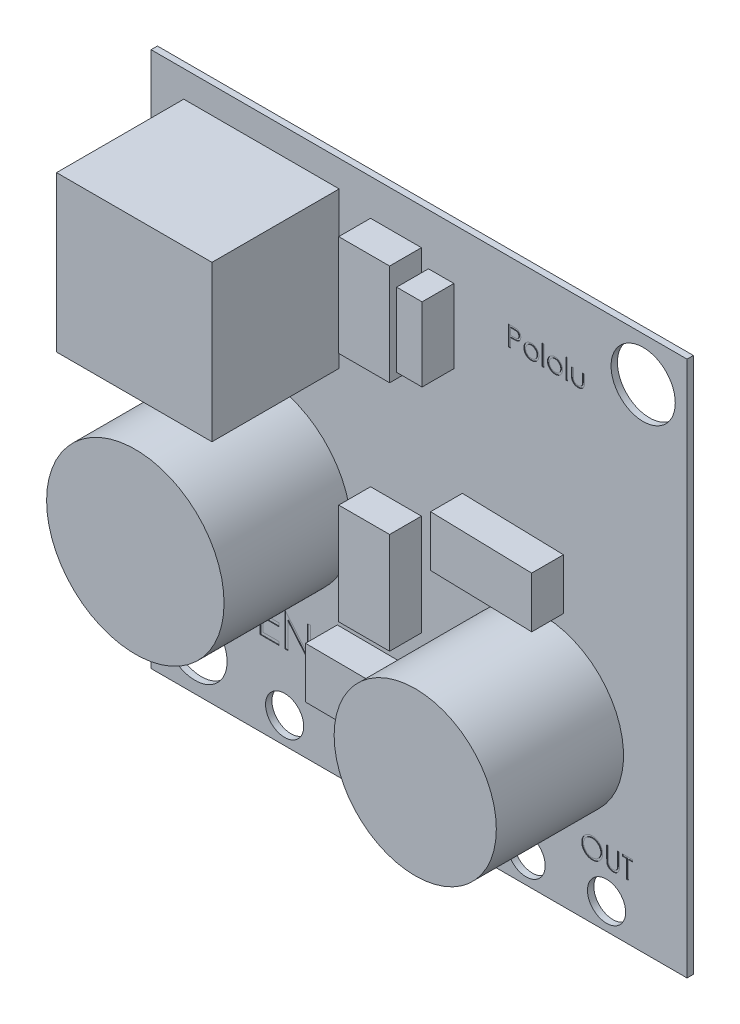
from build123d import *

# Parameters (mm, degrees)
SKETCH1_W           = 21.403638807
SKETCH1_H           = 21.403638807
SKETCH1_R           = 1.2827
SKETCH1_R_2         = 0.762
BOSS_EXTRUDE2_DEPTH = 0.254
SKETCH2_R           = 3.5433
SKETCH2_R_2         = 3.2385
SKETCH2_W           = 6.206288666
SKETCH2_H           = 6.206288667
BOSS_EXTRUDE3_DEPTH = 5.08
SKETCH3_W           = 2.032
SKETCH3_H           = 4.0386
SKETCH3_W_2         = 1.016
SKETCH3_H_2         = 2.9464
BOSS_EXTRUDE4_DEPTH = 1.27
SKETCH4_W           = 0.071233974
SKETCH4_H           = 0.814102564
SKETCH4_W_2         = 0.071233975
SKETCH4_H_2         = 0.79375
CUT_EXTRUDE1_DEPTH  = 0.0254


with BuildPart() as part:
    # Sketch1 → Boss-Extrude2 (new body)
    with BuildSketch(Plane.XY):
        with Locations((9.618180597, 10.120686142)):
            Rectangle(SKETCH1_W, SKETCH1_H)
        with Locations((0.668961193, 1.171466738)):
            Circle(SKETCH1_R, mode=Mode.SUBTRACT)
        with Locations((18.5674, 19.069905545)):
            Circle(SKETCH1_R, mode=Mode.SUBTRACT)
        with Locations((4.250361193, 0.465539417)):
            Circle(SKETCH1_R_2, mode=Mode.SUBTRACT)
        with Locations((7.464288954, 0.465539417)):
            Circle(SKETCH1_R_2, mode=Mode.SUBTRACT)
        with Locations((10.678216716, 0.465539417)):
            Circle(SKETCH1_R_2, mode=Mode.SUBTRACT)
        with Locations((13.892144477, 0.465539417)):
            Circle(SKETCH1_R_2, mode=Mode.SUBTRACT)
        with Locations((17.106072239, 0.465539417)):
            Circle(SKETCH1_R_2, mode=Mode.SUBTRACT)
    extrude(amount=BOSS_EXTRUDE2_DEPTH)

    # Sketch2 → Boss-Extrude3 (add)
    with BuildSketch(Plane.XY.offset(0.254)):
        with Locations((3.367424674, 8.222212501)):
            Circle(SKETCH2_R)
        with Locations((14.545239743, 5.842060174)):
            Circle(SKETCH2_R_2)
        with Locations((3.324815917, 16.660413121)):
            Rectangle(SKETCH2_W, SKETCH2_H)
    extrude(amount=BOSS_EXTRUDE3_DEPTH)

    # Sketch3 → Boss-Extrude4 (add)
    with BuildSketch(Plane.XY.offset(0.254)):
        Polygon((6.3543759, 4.646336431), (10.392892165, 4.620330016), (10.393031369, 2.588330021), (6.354515103, 2.614336436), align=None)
        with Locations((8.696702908, 8.069982675)):
            Rectangle(SKETCH3_W, SKETCH3_H)
        with Locations((8.696702908, 17.354271733)):
            Rectangle(SKETCH3_W, SKETCH3_H)
        Polygon((11.34760699, 11.694074063), (15.38486701, 11.590047681), (15.387094643, 9.558048902), (11.349834623, 9.662075284), align=None)
        with Locations((10.50132769, 17.309698928)):
            Rectangle(SKETCH3_W_2, SKETCH3_H_2)
    extrude(amount=BOSS_EXTRUDE4_DEPTH)

    # Sketch4 → Cut-Extrude1 (cut)
    # profile 1 of 17: a face of its own
    with BuildSketch(Plane.XY.offset(0.254)):
        with BuildLine():
            Line((13.191799409, 18.469298806), (13.347464724, 18.469298806))
            add(Edge.make_bspline(
                [(13.347464724, 18.469298806), (13.358171483, 18.469287037), (13.378686109, 18.469264486), (13.40810363, 18.468580785), (13.434821194, 18.467667589), (13.458781192, 18.466401695), (13.480057342, 18.464905683), (13.498553373, 18.462807453), (13.514414665, 18.460616635), (13.523918449, 18.458389281), (13.528252735, 18.457373476)],
                knots=[0, 0, 0, 0, 1.415646017, 2.712440637, 3.8905458, 4.950247383, 5.884950622, 6.709939814, 7.411656543, 8, 8, 8, 8], degree=3))
            add(Edge.make_bspline(
                [(13.528252735, 18.457373476), (13.533739482, 18.455871712), (13.54458369, 18.452903572), (13.560209462, 18.446958674), (13.575076138, 18.439909683), (13.589234723, 18.43187604), (13.602511231, 18.422513063), (13.615103744, 18.412200297), (13.626901133, 18.400699637), (13.637837055, 18.388140077), (13.647880215, 18.374732458), (13.656527482, 18.36027663), (13.663768121, 18.345015924), (13.669978256, 18.328960954), (13.674447852, 18.311976898), (13.677814917, 18.294181769), (13.679952061, 18.275577473), (13.680156749, 18.262863896), (13.680260948, 18.256391905)],
                knots=[0, 0, 0, 0, 0.999701418, 1.975846123, 2.934577507, 3.890451536, 4.834027766, 5.787354733, 6.749476667, 7.726910423, 8.712836071, 9.690891519, 10.682875813, 11.679750201, 12.712814741, 13.765529915, 14.8625177, 16, 16, 16, 16], degree=3))
            add(Edge.make_bspline(
                [(13.680260948, 18.256391905), (13.680165375, 18.249865517), (13.679978379, 18.237096196), (13.677734043, 18.218415225), (13.674710946, 18.200563018), (13.670062508, 18.183579161), (13.663974292, 18.167564513), (13.656832345, 18.152274341), (13.648218223, 18.137968772), (13.638320199, 18.124595872), (13.627309391, 18.112143089), (13.615232385, 18.100700662), (13.602137938, 18.090335571), (13.588067666, 18.081024579), (13.572884396, 18.072983601), (13.556818408, 18.065781498), (13.539730055, 18.059732883), (13.527904878, 18.056551065), (13.521892558, 18.054933322)],
                knots=[0, 0, 0, 0, 1.121902311, 2.195077645, 3.232258892, 4.234102512, 5.217864754, 6.176164875, 7.132989551, 8.084763148, 9.034132444, 9.988522005, 10.94243251, 11.903244335, 12.886203696, 13.894208494, 14.929344452, 16, 16, 16, 16], degree=3))
            add(Edge.make_bspline(
                [(13.521892558, 18.054933322), (13.516919752, 18.053875824), (13.506021558, 18.051558257), (13.48807312, 18.048970982), (13.467175863, 18.046762633), (13.44335831, 18.045106839), (13.41664184, 18.043689345), (13.387012002, 18.042562652), (13.35441063, 18.041943561), (13.331670545, 18.041911631), (13.319797957, 18.04189496)],
                knots=[0, 0, 0, 0, 0.601384939, 1.31797006, 2.144135048, 3.087295005, 4.142315834, 5.309527816, 6.595305764, 8, 8, 8, 8], degree=3))
            Line((13.319797957, 18.04189496), (13.263033384, 18.04189496))
            Line((13.263033384, 18.04189496), (13.263033384, 17.675548806))
            Line((13.263033384, 17.675548806), (13.191799409, 17.675548806))
            Line((13.191799409, 17.675548806), (13.191799409, 18.469298806))
        make_face()
        with BuildLine():
            Line((13.263033384, 18.38788855), (13.263033384, 18.123305217))
            Line((13.263033384, 18.123305217), (13.402003235, 18.121556168))
            add(Edge.make_bspline(
                [(13.402003235, 18.121556168), (13.408788647, 18.121552661), (13.421887745, 18.121545891), (13.440809888, 18.122449683), (13.458365209, 18.123493018), (13.474499782, 18.125020629), (13.489220881, 18.127179914), (13.502553053, 18.129359719), (13.514392919, 18.132513257), (13.528249345, 18.136759381), (13.543689676, 18.144001242), (13.560487138, 18.154512735), (13.57472261, 18.167911396), (13.587041224, 18.182976279), (13.596817021, 18.199735546), (13.603973469, 18.217667251), (13.608178339, 18.236587496), (13.608742172, 18.24953427), (13.609026973, 18.256073896)],
                knots=[0, 0, 0, 0, 1.160613943, 2.240541288, 3.23993089, 4.169200891, 5.011653406, 5.7853311, 6.478053781, 7.106038997, 8.262395093, 9.384106736, 10.481365981, 11.59014053, 12.70357646, 13.786202915, 14.881775077, 16, 16, 16, 16], degree=3))
            add(Edge.make_bspline(
                [(13.609026973, 18.256073896), (13.608740623, 18.262455309), (13.608171394, 18.275140768), (13.603940511, 18.29373238), (13.596830935, 18.31147512), (13.5869756, 18.328024374), (13.575014665, 18.343035049), (13.56111285, 18.356074576), (13.545302878, 18.366556998), (13.530596226, 18.37332276), (13.517533099, 18.377453724), (13.506186566, 18.380344072), (13.493375288, 18.382651754), (13.479095095, 18.384520355), (13.46345667, 18.38611998), (13.446325659, 18.387205371), (13.427766958, 18.387840701), (13.414883132, 18.387872214), (13.408204407, 18.38788855)],
                knots=[0, 0, 0, 0, 1.120700087, 2.227813068, 3.331159281, 4.466773991, 5.599788987, 6.693661531, 7.80175334, 8.91857717, 9.525282508, 10.207424825, 10.974604443, 11.810962634, 12.737642355, 13.736264703, 14.826523623, 16, 16, 16, 16], degree=3))
            Line((13.408204407, 18.38788855), (13.263033384, 18.38788855))
        make_face(mode=Mode.SUBTRACT)
    # profile 2 of 17: a face of its own
    with BuildSketch(Plane.XY.offset(0.254)):
        with BuildLine():
            add(Edge.make_bspline(
                [(14.102894662, 18.265773165), (14.113778397, 18.265541415), (14.135118741, 18.265087009), (14.166371601, 18.260230401), (14.196204159, 18.252803767), (14.22473067, 18.242536823), (14.251585794, 18.228775024), (14.277160702, 18.212353631), (14.301385273, 18.192899364), (14.315904782, 18.177850302), (14.32327477, 18.170211517)],
                knots=[0, 0, 0, 0, 1.054011418, 2.066658804, 3.057071809, 4.030435133, 4.997543892, 5.974964718, 6.972108034, 8, 8, 8, 8], degree=3))
            add(Edge.make_bspline(
                [(14.32327477, 18.170211517), (14.329620677, 18.162905845), (14.342189681, 18.148435886), (14.358306371, 18.124973631), (14.372190546, 18.100675787), (14.383317325, 18.075219697), (14.392090536, 18.048827584), (14.398319363, 18.021408735), (14.402024347, 17.993023703), (14.402523948, 17.973746046), (14.402776973, 17.963982801)],
                knots=[0, 0, 0, 0, 1.025258237, 2.030674902, 3.01204498, 3.988269485, 4.97094183, 5.956517959, 6.965070386, 8, 8, 8, 8], degree=3))
            add(Edge.make_bspline(
                [(14.402776973, 17.963982801), (14.40255442, 17.954162966), (14.402114644, 17.934758515), (14.397954574, 17.906179123), (14.391484132, 17.878467083), (14.382224054, 17.851738415), (14.370349983, 17.825911417), (14.355860488, 17.801098894), (14.338653889, 17.777251892), (14.319149411, 17.754572904), (14.297593003, 17.733670923), (14.274207734, 17.715453619), (14.249453158, 17.699845881), (14.223000112, 17.687273694), (14.195090164, 17.677360958), (14.165663115, 17.670398633), (14.134764679, 17.666189108), (14.113667434, 17.665648548), (14.102894662, 17.665372524)],
                knots=[0, 0, 0, 0, 0.998656419, 1.973391657, 2.932242238, 3.890759089, 4.846373663, 5.82037756, 6.809684879, 7.83454468, 8.860553229, 9.859544525, 10.845671541, 11.83227036, 12.833544569, 13.85385346, 14.904124723, 16, 16, 16, 16], degree=3))
            add(Edge.make_bspline(
                [(14.102894662, 17.665372524), (14.092069109, 17.665649474), (14.070866718, 17.666191894), (14.039859218, 17.670382278), (14.01037943, 17.677357749), (13.982432944, 17.68730627), (13.955866166, 17.699846283), (13.930968157, 17.715406434), (13.907563891, 17.733676326), (13.886002923, 17.75457144), (13.866499668, 17.77725227), (13.849292753, 17.801098796), (13.83480334, 17.825911442), (13.822929247, 17.851738408), (13.813669175, 17.878467085), (13.807198731, 17.906179123), (13.803038661, 17.934758515), (13.802598886, 17.954162966), (13.802376332, 17.963982801)],
                knots=[0, 0, 0, 0, 1.099876186, 2.154163076, 3.173186993, 4.173200201, 5.163417411, 6.152872554, 7.150605724, 8.17532212, 9.198891216, 10.186952605, 11.159729845, 12.11414092, 13.071450619, 14.029093627, 15.002601286, 16, 16, 16, 16], degree=3))
            add(Edge.make_bspline(
                [(13.802376332, 17.963982801), (13.802631083, 17.973692982), (13.803135446, 17.992917471), (13.806836704, 18.021249144), (13.813041234, 18.048621587), (13.821824961, 18.074911829), (13.833054299, 18.100256366), (13.846743377, 18.124614247), (13.863024467, 18.147970409), (13.875543481, 18.162421666), (13.881878536, 18.169734503)],
                knots=[0, 0, 0, 0, 1.031353054, 2.041901799, 3.029428768, 4.008703097, 4.981709435, 5.96992636, 6.972712378, 8, 8, 8, 8], degree=3))
            add(Edge.make_bspline(
                [(13.881878536, 18.169734503), (13.889237413, 18.177439534), (13.903709939, 18.192592833), (13.928055097, 18.211990388), (13.953567088, 18.228753497), (13.980718991, 18.242241853), (14.009222068, 18.25286416), (14.039207503, 18.260249554), (14.070566415, 18.265069511), (14.092011186, 18.265536276), (14.102894662, 18.265773165)],
                knots=[0, 0, 0, 0, 1.027980169, 2.021703884, 2.998553061, 3.971491411, 4.943284454, 5.930300938, 6.949603206, 8, 8, 8, 8], degree=3))
        make_face()
        with BuildLine():
            add(Edge.make_bspline(
                [(14.102576653, 18.194539191), (14.094880087, 18.194320435), (14.079685642, 18.193888571), (14.057320129, 18.190603829), (14.035789059, 18.185399662), (14.015051581, 18.178005528), (13.99517763, 18.168458099), (13.976148176, 18.156731382), (13.957907248, 18.142980694), (13.940811673, 18.127227552), (13.925122113, 18.11001928), (13.911406571, 18.091684027), (13.899744092, 18.072519195), (13.890028556, 18.052504854), (13.882792461, 18.031438182), (13.877537151, 18.009557753), (13.874255507, 17.986818989), (13.873827703, 17.971361044), (13.873610307, 17.963505788)],
                knots=[0, 0, 0, 0, 1.021534396, 2.016698045, 2.994645724, 3.958388632, 4.93408049, 5.916473867, 6.921342795, 7.962252576, 8.998418191, 10.008913653, 10.997312074, 11.973003931, 12.956656626, 13.948281152, 14.957379055, 16, 16, 16, 16], degree=3))
            add(Edge.make_bspline(
                [(13.873610307, 17.963505788), (13.873974711, 17.953356667), (13.874697986, 17.933212561), (13.880579728, 17.903546467), (13.890419116, 17.875066297), (13.903705874, 17.847939009), (13.920353356, 17.822840118), (13.939967387, 17.800462835), (13.962337462, 17.78114391), (13.987196918, 17.765114504), (14.014037987, 17.752378273), (14.042444331, 17.743352434), (14.072071774, 17.737485104), (14.092319368, 17.73690193), (14.102576653, 17.736606499)],
                knots=[0, 0, 0, 0, 1.016792936, 2.018143844, 3.017858371, 4.030088057, 5.03801393, 6.028138512, 7.003788237, 7.991172063, 8.984598303, 9.972568034, 10.972917682, 12, 12, 12, 12], degree=3))
            add(Edge.make_bspline(
                [(14.102576653, 17.736606499), (14.112833347, 17.736903651), (14.133079777, 17.737490223), (14.162666055, 17.743322884), (14.190994759, 17.752417821), (14.217807949, 17.76510018), (14.242656089, 17.781204781), (14.265187051, 17.800353745), (14.284633611, 17.822899386), (14.301264624, 17.847972254), (14.314768975, 17.875024241), (14.324562308, 17.903551723), (14.330458189, 17.933211222), (14.331179556, 17.953356219), (14.331542999, 17.963505788)],
                knots=[0, 0, 0, 0, 1.02726834, 2.027799167, 3.010890988, 4.004497153, 4.992059811, 5.971914811, 6.958719428, 7.966827853, 8.981595046, 9.981490638, 10.983022906, 12, 12, 12, 12], degree=3))
            add(Edge.make_bspline(
                [(14.331542999, 17.963505788), (14.331325677, 17.971361091), (14.330898021, 17.986819128), (14.327615305, 18.009557221), (14.32236396, 18.031440136), (14.315113254, 18.052497644), (14.305439933, 18.072571016), (14.293552553, 18.091627757), (14.279893017, 18.110082795), (14.264014134, 18.127171925), (14.246936404, 18.142986835), (14.228688083, 18.156736714), (14.209686846, 18.168406562), (14.189870632, 18.178087191), (14.169130496, 18.185332392), (14.147629594, 18.190633878), (14.125359506, 18.19387469), (14.110219509, 18.194316274), (14.102576653, 18.194539191)],
                knots=[0, 0, 0, 0, 1.042956736, 2.052379634, 3.044323526, 4.02829302, 5.004299113, 5.996692471, 7.007513377, 8.048758398, 9.090003419, 10.095195979, 11.07790575, 12.047570684, 13.018257071, 13.989683339, 14.985167495, 16, 16, 16, 16], degree=3))
        make_face(mode=Mode.SUBTRACT)
    # profile 3 of 17: a face of its own
    with BuildSketch(Plane.XY.offset(0.254)):
        with Locations((14.570685627, 18.082600088)):
            Rectangle(SKETCH4_W, SKETCH4_H)
    # profile 4 of 17: a face of its own
    with BuildSketch(Plane.XY.offset(0.254)):
        with BuildLine():
            add(Edge.make_bspline(
                [(15.049288892, 18.265773165), (15.060172628, 18.265541415), (15.081512972, 18.265087009), (15.112765832, 18.260230401), (15.14259839, 18.252803767), (15.171124901, 18.242536823), (15.197980025, 18.228775024), (15.223554932, 18.212353631), (15.247779504, 18.192899364), (15.262299012, 18.177850302), (15.269669001, 18.170211517)],
                knots=[0, 0, 0, 0, 1.054011418, 2.066658804, 3.057071809, 4.030435133, 4.997543892, 5.974964718, 6.972108034, 8, 8, 8, 8], degree=3))
            add(Edge.make_bspline(
                [(15.269669001, 18.170211517), (15.276014908, 18.162905845), (15.288583912, 18.148435886), (15.304700602, 18.124973631), (15.318584777, 18.100675787), (15.329711556, 18.075219697), (15.338484767, 18.048827584), (15.344713594, 18.021408735), (15.348418578, 17.993023703), (15.348918179, 17.973746046), (15.349171204, 17.963982801)],
                knots=[0, 0, 0, 0, 1.025258237, 2.030674902, 3.01204498, 3.988269485, 4.97094183, 5.956517959, 6.965070386, 8, 8, 8, 8], degree=3))
            add(Edge.make_bspline(
                [(15.349171204, 17.963982801), (15.348948651, 17.954162966), (15.348508875, 17.934758515), (15.344348805, 17.906179123), (15.337878362, 17.878467083), (15.328618285, 17.851738415), (15.316744214, 17.825911417), (15.302254718, 17.801098894), (15.285048119, 17.777251892), (15.265543642, 17.754572904), (15.243987234, 17.733670923), (15.220601965, 17.715453619), (15.195847389, 17.699845881), (15.169394343, 17.687273694), (15.141484395, 17.677360958), (15.112057346, 17.670398633), (15.08115891, 17.666189108), (15.060061665, 17.665648548), (15.049288892, 17.665372524)],
                knots=[0, 0, 0, 0, 0.998656419, 1.973391657, 2.932242238, 3.890759089, 4.846373663, 5.82037756, 6.809684879, 7.83454468, 8.860553229, 9.859544525, 10.845671541, 11.83227036, 12.833544569, 13.85385346, 14.904124723, 16, 16, 16, 16], degree=3))
            add(Edge.make_bspline(
                [(15.049288892, 17.665372524), (15.03846334, 17.665649474), (15.017260949, 17.666191894), (14.986253449, 17.670382278), (14.956773661, 17.677357749), (14.928827175, 17.68730627), (14.902260397, 17.699846283), (14.877362388, 17.715406434), (14.853958121, 17.733676326), (14.832397153, 17.75457144), (14.812893898, 17.77725227), (14.795686984, 17.801098796), (14.781197571, 17.825911442), (14.769323478, 17.851738408), (14.760063406, 17.878467085), (14.753592962, 17.906179123), (14.749432892, 17.934758515), (14.748993116, 17.954162966), (14.748770563, 17.963982801)],
                knots=[0, 0, 0, 0, 1.099876186, 2.154163076, 3.173186993, 4.173200201, 5.163417411, 6.152872554, 7.150605724, 8.17532212, 9.198891216, 10.186952605, 11.159729845, 12.11414092, 13.071450619, 14.029093627, 15.002601286, 16, 16, 16, 16], degree=3))
            add(Edge.make_bspline(
                [(14.748770563, 17.963982801), (14.749025314, 17.973692982), (14.749529677, 17.992917471), (14.753230935, 18.021249144), (14.759435465, 18.048621587), (14.768219192, 18.074911829), (14.77944853, 18.100256366), (14.793137608, 18.124614247), (14.809418698, 18.147970409), (14.821937712, 18.162421666), (14.828272767, 18.169734503)],
                knots=[0, 0, 0, 0, 1.031353054, 2.041901799, 3.029428768, 4.008703097, 4.981709435, 5.96992636, 6.972712378, 8, 8, 8, 8], degree=3))
            add(Edge.make_bspline(
                [(14.828272767, 18.169734503), (14.835631644, 18.177439534), (14.85010417, 18.192592833), (14.874449328, 18.211990388), (14.899961319, 18.228753497), (14.927113222, 18.242241853), (14.955616299, 18.25286416), (14.985601734, 18.260249554), (15.016960646, 18.265069511), (15.038405417, 18.265536276), (15.049288892, 18.265773165)],
                knots=[0, 0, 0, 0, 1.027980169, 2.021703884, 2.998553061, 3.971491411, 4.943284454, 5.930300938, 6.949603206, 8, 8, 8, 8], degree=3))
        make_face()
        with BuildLine():
            add(Edge.make_bspline(
                [(15.048970884, 18.194539191), (15.041274318, 18.194320435), (15.026079873, 18.193888571), (15.00371436, 18.190603829), (14.982183289, 18.185399662), (14.961445812, 18.178005528), (14.941571861, 18.168458099), (14.922542407, 18.156731382), (14.904301479, 18.142980694), (14.887205903, 18.127227552), (14.871516343, 18.11001928), (14.857800802, 18.091684027), (14.846138323, 18.072519195), (14.836422787, 18.052504854), (14.829186692, 18.031438182), (14.823931382, 18.009557753), (14.820649738, 17.986818989), (14.820221934, 17.971361044), (14.820004537, 17.963505788)],
                knots=[0, 0, 0, 0, 1.021534396, 2.016698045, 2.994645724, 3.958388632, 4.93408049, 5.916473867, 6.921342795, 7.962252576, 8.998418191, 10.008913653, 10.997312074, 11.973003931, 12.956656626, 13.948281152, 14.957379055, 16, 16, 16, 16], degree=3))
            add(Edge.make_bspline(
                [(14.820004537, 17.963505788), (14.820368942, 17.953356667), (14.821092217, 17.933212561), (14.826973958, 17.903546467), (14.836813347, 17.875066297), (14.850100105, 17.847939009), (14.866747587, 17.822840118), (14.886361618, 17.800462835), (14.908731693, 17.78114391), (14.933591149, 17.765114504), (14.960432218, 17.752378273), (14.988838562, 17.743352434), (15.018466005, 17.737485104), (15.038713599, 17.73690193), (15.048970884, 17.736606499)],
                knots=[0, 0, 0, 0, 1.016792936, 2.018143844, 3.017858371, 4.030088057, 5.03801393, 6.028138512, 7.003788237, 7.991172063, 8.984598303, 9.972568034, 10.972917682, 12, 12, 12, 12], degree=3))
            add(Edge.make_bspline(
                [(15.048970884, 17.736606499), (15.059227578, 17.736903651), (15.079474008, 17.737490223), (15.109060285, 17.743322884), (15.13738899, 17.752417821), (15.164202179, 17.76510018), (15.18905032, 17.781204781), (15.211581281, 17.800353745), (15.231027841, 17.822899386), (15.247658855, 17.847972254), (15.261163206, 17.875024241), (15.270956539, 17.903551723), (15.27685242, 17.933211222), (15.277573787, 17.953356219), (15.27793723, 17.963505788)],
                knots=[0, 0, 0, 0, 1.02726834, 2.027799167, 3.010890988, 4.004497153, 4.992059811, 5.971914811, 6.958719428, 7.966827853, 8.981595046, 9.981490638, 10.983022906, 12, 12, 12, 12], degree=3))
            add(Edge.make_bspline(
                [(15.27793723, 17.963505788), (15.277719908, 17.971361091), (15.277292251, 17.986819128), (15.274009536, 18.009557221), (15.268758191, 18.031440136), (15.261507485, 18.052497644), (15.251834164, 18.072571016), (15.239946784, 18.091627757), (15.226287248, 18.110082795), (15.210408365, 18.127171925), (15.193330635, 18.142986835), (15.175082313, 18.156736714), (15.156081077, 18.168406562), (15.136264863, 18.178087191), (15.115524727, 18.185332392), (15.094023824, 18.190633878), (15.071753737, 18.19387469), (15.05661374, 18.194316274), (15.048970884, 18.194539191)],
                knots=[0, 0, 0, 0, 1.042956736, 2.052379634, 3.044323526, 4.02829302, 5.004299113, 5.996692471, 7.007513377, 8.048758398, 9.090003419, 10.095195979, 11.07790575, 12.047570684, 13.018257071, 13.989683339, 14.985167495, 16, 16, 16, 16], degree=3))
        make_face(mode=Mode.SUBTRACT)
    # profile 5 of 17: a face of its own
    with BuildSketch(Plane.XY.offset(0.254)):
        with Locations((15.517079858, 18.082600088)):
            Rectangle(SKETCH4_W, SKETCH4_H)
    # profile 6 of 17: a face of its own
    with BuildSketch(Plane.XY.offset(0.254)):
        with BuildLine():
            Line((15.705341076, 18.255596883), (15.77657505, 18.255596883))
            Line((15.77657505, 18.255596883), (15.77657505, 17.986561427))
            add(Edge.make_bspline(
                [(15.77657505, 17.986561427), (15.776607232, 17.978664124), (15.776668795, 17.963556956), (15.777086294, 17.941818369), (15.778068297, 17.921993507), (15.779296075, 17.904070918), (15.780874989, 17.888053635), (15.782753536, 17.873997602), (15.784853214, 17.861743421), (15.786908508, 17.854363053), (15.787864363, 17.850930667)],
                knots=[0, 0, 0, 0, 1.388932606, 2.656963016, 3.823490214, 4.879454478, 5.816252168, 6.653371382, 7.373723809, 8, 8, 8, 8], degree=3))
            add(Edge.make_bspline(
                [(15.787864363, 17.850930667), (15.789397765, 17.846616552), (15.792432688, 17.838078011), (15.797937568, 17.825743361), (15.804747565, 17.814318967), (15.812199705, 17.803364293), (15.820794749, 17.793203843), (15.830423951, 17.783854773), (15.840764979, 17.774963845), (15.856130851, 17.764444437), (15.877144649, 17.75316971), (15.904733756, 17.743441552), (15.93464775, 17.737627714), (15.955322606, 17.736953195), (15.965949299, 17.736606499)],
                knots=[0, 0, 0, 0, 0.725840625, 1.436591201, 2.137033971, 2.831655856, 3.53531722, 4.242432219, 4.957935707, 5.694543706, 7.190802206, 8.724350549, 10.316345118, 12, 12, 12, 12], degree=3))
            add(Edge.make_bspline(
                [(15.965949299, 17.736606499), (15.976575005, 17.736960568), (15.997133781, 17.737645625), (16.026719104, 17.743266178), (16.053763621, 17.752656397), (16.077995891, 17.765766292), (16.099306001, 17.781809581), (16.117064324, 17.800634793), (16.131716327, 17.82164635), (16.13811382, 17.837322749), (16.14133116, 17.845206509)],
                knots=[0, 0, 0, 0, 1.157059328, 2.238695713, 3.266970494, 4.264342957, 5.228770407, 6.160125903, 7.074715775, 8, 8, 8, 8], degree=3))
            add(Edge.make_bspline(
                [(16.14133116, 17.845206509), (16.142282352, 17.848373866), (16.144385204, 17.855376118), (16.146644523, 17.867255097), (16.148679802, 17.881421177), (16.150417701, 17.897967057), (16.151657122, 17.916849497), (16.152325239, 17.938062596), (16.153080044, 17.961539762), (16.1530915, 17.977974414), (16.153097486, 17.986561427)],
                knots=[0, 0, 0, 0, 0.557542046, 1.232589297, 2.036731608, 2.971723315, 4.038036528, 5.22795436, 6.551621927, 8, 8, 8, 8], degree=3))
            Line((16.153097486, 17.986561427), (16.153097486, 18.255596883))
            Line((16.153097486, 18.255596883), (16.224331461, 18.255596883))
            Line((16.224331461, 18.255596883), (16.224331461, 17.973205056))
            add(Edge.make_bspline(
                [(16.224331461, 17.973205056), (16.22423129, 17.963610394), (16.224036947, 17.944995437), (16.22278796, 17.917943505), (16.220644923, 17.892733496), (16.217392207, 17.869352066), (16.213567313, 17.847817065), (16.208633301, 17.828100894), (16.202741808, 17.810264299), (16.196095735, 17.793994289), (16.188243991, 17.779242583), (16.179892148, 17.765241781), (16.170248138, 17.752339276), (16.160094888, 17.739892792), (16.148800584, 17.72852141), (16.136576866, 17.7179642), (16.123595783, 17.70805978), (16.109569269, 17.699194437), (16.09470209, 17.691207804), (16.078975894, 17.684128444), (16.06219806, 17.678526252), (16.044585057, 17.673693298), (16.026050591, 17.669902695), (16.00661253, 17.66722967), (15.986277423, 17.665591068), (15.97241867, 17.665446595), (15.965313281, 17.665372524)],
                knots=[0, 0, 0, 0, 1.493040784, 2.896703357, 4.213163133, 5.428574705, 6.569057535, 7.615249723, 8.588095153, 9.490268104, 10.346124644, 11.18633936, 12.024365274, 12.850166724, 13.684164916, 14.514361689, 15.362232829, 16.222528818, 17.093394965, 17.986930858, 18.902426812, 19.842810585, 20.827885679, 21.843828298, 22.894529745, 24, 24, 24, 24], degree=3))
            add(Edge.make_bspline(
                [(15.965313281, 17.665372524), (15.958261036, 17.665449565), (15.944402718, 17.665600957), (15.924066561, 17.667220617), (15.904574645, 17.669898542), (15.885996269, 17.673721064), (15.868312789, 17.678492425), (15.851452578, 17.684162869), (15.835613055, 17.691211479), (15.820603922, 17.699143889), (15.806542666, 17.708116728), (15.793364471, 17.71795198), (15.781087006, 17.728634962), (15.769707564, 17.740121059), (15.759385871, 17.752552757), (15.749993305, 17.765830054), (15.741385266, 17.779821392), (15.733594544, 17.794803573), (15.726901699, 17.811261868), (15.720992742, 17.829472103), (15.716159794, 17.849633924), (15.712226769, 17.871730093), (15.709062782, 17.895654862), (15.706866103, 17.921546627), (15.70563787, 17.949342322), (15.70544214, 17.968539707), (15.705341076, 17.978452202)],
                knots=[0, 0, 0, 0, 1.083640291, 2.129454052, 3.13281866, 4.105697902, 5.042300162, 5.946461698, 6.836384745, 7.703652036, 8.553297018, 9.397182691, 10.228592656, 11.052265423, 11.879314572, 12.708807002, 13.549817954, 14.402308542, 15.300838682, 16.27712199, 17.341985831, 18.484375296, 19.725102775, 21.0496083, 22.476576903, 24, 24, 24, 24], degree=3))
            Line((15.705341076, 17.978452202), (15.705341076, 18.255596883))
        make_face()
    # profile 7 of 17: a face of its own
    with BuildSketch(Plane.XY.offset(0.254)):
        Polygon((3.27317911, 4.096791439), (4.019439794, 4.096791439), (4.019439794, 3.961107678), (3.3919024, 3.961107678), (3.3919024, 3.554056396), (4.019439794, 3.554056396), (4.019439794, 3.418372636), (3.3919024, 3.418372636), (3.3919024, 2.909558533), (4.019439794, 2.909558533), (4.019439794, 2.773874772), (3.27317911, 2.773874772), align=None)
    # profile 8 of 17: a face of its own
    with BuildSketch(Plane.XY.offset(0.254)):
        Polygon((4.256886375, 2.773874772), (4.256886375, 4.096791439), (4.281797065, 4.096791439), (5.155791289, 3.05557758), (5.155791289, 4.096791439), (5.27451458, 4.096791439), (5.27451458, 2.773874772), (5.247483831, 2.773874772), (4.375609665, 3.812703565), (4.375609665, 2.773874772), align=None)
    # profile 9 of 17: a face of its own
    with BuildSketch(Plane.XY.offset(0.254)):
        Polygon((7.071247738, 2.423342648), (7.147569853, 2.423342648), (7.412153187, 1.79781931), (7.67673652, 2.423342648), (7.753058635, 2.423342648), (7.417241328, 1.629592648), (7.407065046, 1.629592648), align=None)
    # profile 10 of 17: a face of its own
    with BuildSketch(Plane.XY.offset(0.254)):
        with Locations((7.931143572, 2.026467648)):
            Rectangle(SKETCH4_W_2, SKETCH4_H_2)
    # profile 11 of 17: a face of its own
    with BuildSketch(Plane.XY.offset(0.254)):
        Polygon((8.1702862, 1.629592648), (8.1702862, 2.423342648), (8.185232614, 2.423342648), (8.709629148, 1.798614332), (8.709629148, 2.423342648), (8.780863123, 2.423342648), (8.780863123, 1.629592648), (8.764644673, 1.629592648), (8.241520174, 2.252889923), (8.241520174, 1.629592648), align=None)
    # profile 12 of 17: a face of its own
    with BuildSketch(Plane.XY.offset(0.254)):
        with BuildLine():
            Line((11.203994747, 2.287870893), (11.142937054, 2.229993289))
            add(Edge.make_bspline(
                [(11.142937054, 2.229993289), (11.131888307, 2.240387074), (11.110054275, 2.260926798), (11.074457934, 2.287576613), (11.037318681, 2.310406246), (10.998830311, 2.328981411), (10.959945961, 2.343802483), (10.921181756, 2.354354401), (10.88293532, 2.361083708), (10.857497397, 2.361888428), (10.844962796, 2.362284955)],
                knots=[0, 0, 0, 0, 1.08915593, 2.152340314, 3.188132944, 4.216796309, 5.218260357, 6.173443236, 7.099959455, 8, 8, 8, 8], degree=3))
            add(Edge.make_bspline(
                [(10.844962796, 2.362284955), (10.837271426, 2.362191155), (10.821908635, 2.362003799), (10.799089016, 2.359612521), (10.776508725, 2.356173347), (10.754210388, 2.351197243), (10.73215065, 2.344890545), (10.710406233, 2.337001699), (10.688936576, 2.327804349), (10.667943911, 2.317176609), (10.647592047, 2.305501716), (10.628370407, 2.292563922), (10.610156476, 2.278777892), (10.593292594, 2.263798474), (10.577681757, 2.247761353), (10.562952394, 2.230964853), (10.549622543, 2.21295008), (10.537582225, 2.194048483), (10.526841287, 2.17459204), (10.517359681, 2.154768023), (10.509400163, 2.134642184), (10.503102447, 2.11418927), (10.497906638, 2.093567511), (10.494251395, 2.072634119), (10.492190656, 2.05136668), (10.491834199, 2.037125159), (10.491655003, 2.029965745)],
                knots=[0, 0, 0, 0, 1.02818874, 2.053710826, 3.065248034, 4.081641283, 5.106893873, 6.131558223, 7.173050175, 8.228653731, 9.27666206, 10.308777013, 11.325269123, 12.329503258, 13.32196095, 14.316845687, 15.314881793, 16.315733098, 17.311955233, 18.285320748, 19.252783886, 20.203351036, 21.145449891, 22.095197417, 23.042428769, 24, 24, 24, 24], degree=3))
            add(Edge.make_bspline(
                [(10.491655003, 2.029965745), (10.491826389, 2.022647184), (10.492168693, 2.008030048), (10.494359516, 1.986214607), (10.498425385, 1.964723167), (10.503860919, 1.943485108), (10.510660139, 1.922464058), (10.519135726, 1.901751149), (10.529174532, 1.88134715), (10.54079425, 1.861435904), (10.553536478, 1.842040504), (10.56781107, 1.823770756), (10.582974095, 1.806383372), (10.599577962, 1.790264404), (10.617090251, 1.774982699), (10.636034178, 1.760959286), (10.656037236, 1.747924047), (10.677129943, 1.736041264), (10.699083431, 1.725425757), (10.721593444, 1.715986052), (10.744731895, 1.708211988), (10.768377184, 1.701876025), (10.792501122, 1.696682565), (10.817226163, 1.693341449), (10.84237051, 1.690916921), (10.859320164, 1.69073965), (10.86785943, 1.69065034)],
                knots=[0, 0, 0, 0, 0.93586088, 1.869166235, 2.799637598, 3.729985548, 4.670839027, 5.622275134, 6.589130586, 7.576015415, 8.568469353, 9.55398029, 10.53834874, 11.515998671, 12.510579167, 13.508179873, 14.527009472, 15.561807829, 16.601455013, 17.643573243, 18.680854198, 19.719860599, 20.772568776, 21.833555941, 22.908541556, 24, 24, 24, 24], degree=3))
            add(Edge.make_bspline(
                [(10.86785943, 1.69065034), (10.878150591, 1.690865463), (10.898358957, 1.691287894), (10.928064811, 1.694576352), (10.956595151, 1.699712321), (10.983869808, 1.707233873), (11.00992046, 1.716827742), (11.03484261, 1.728392767), (11.058440039, 1.742372532), (11.080783688, 1.758150892), (11.101366121, 1.775730148), (11.119929467, 1.794699516), (11.13617764, 1.814966916), (11.150352813, 1.836412979), (11.162079597, 1.859215218), (11.171705017, 1.883261888), (11.179083103, 1.908563806), (11.18211182, 1.926047087), (11.183642183, 1.934881109)],
                knots=[0, 0, 0, 0, 1.13008108, 2.219097802, 3.278683437, 4.311054135, 5.322181354, 6.324827112, 7.324222904, 8.330512327, 9.32562643, 10.293043162, 11.24128371, 12.174520618, 13.111833804, 14.052305215, 15.015860969, 16, 16, 16, 16], degree=3))
            Line((11.183642183, 1.934881109), (10.919058849, 1.934881109))
            Line((10.919058849, 1.934881109), (10.919058849, 2.016291366))
            Line((10.919058849, 2.016291366), (11.254876157, 2.016291366))
            add(Edge.make_bspline(
                [(11.254876157, 2.016291366), (11.254489295, 2.001117703), (11.253732136, 1.971420104), (11.248421061, 1.928110775), (11.239844816, 1.887205052), (11.228128995, 1.848659855), (11.212962637, 1.812529808), (11.19450851, 1.778778228), (11.172471261, 1.747623159), (11.147635857, 1.71881026), (11.119763903, 1.693108814), (11.089608519, 1.67051961), (11.057119885, 1.651491695), (11.022328732, 1.636011152), (10.985348956, 1.623929371), (10.946094984, 1.615363317), (10.904620049, 1.610231165), (10.876195481, 1.609575441), (10.861658258, 1.609240084)],
                knots=[0, 0, 0, 0, 1.140356446, 2.231883559, 3.274166699, 4.278491846, 5.25512956, 6.21435461, 7.1637429, 8.11826594, 9.068280886, 10.0076534, 10.945064095, 11.891975133, 12.864533718, 13.863980011, 14.907571808, 16, 16, 16, 16], degree=3))
            add(Edge.make_bspline(
                [(10.861658258, 1.609240084), (10.852697924, 1.609369152), (10.835025257, 1.609623717), (10.808924279, 1.611432865), (10.783542961, 1.614217925), (10.758885002, 1.618423694), (10.734859699, 1.623575053), (10.711587044, 1.630171505), (10.688978381, 1.637807085), (10.666998766, 1.646491997), (10.645847699, 1.656554855), (10.625430971, 1.667737576), (10.605635725, 1.679982499), (10.5865968, 1.693501388), (10.568214996, 1.708193124), (10.55060884, 1.724087156), (10.533679768, 1.741134892), (10.523075163, 1.753240489), (10.517731726, 1.759340244)],
                knots=[0, 0, 0, 0, 1.107784379, 2.184907829, 3.233506516, 4.263428166, 5.276301166, 6.270063455, 7.25232949, 8.225834625, 9.190232166, 10.146266622, 11.1027726, 12.066435141, 13.031522626, 14.010570082, 14.99756817, 16, 16, 16, 16], degree=3))
            add(Edge.make_bspline(
                [(10.517731726, 1.759340244), (10.509978845, 1.769017338), (10.494601773, 1.788210898), (10.474808334, 1.818963028), (10.457935158, 1.850804164), (10.444244599, 1.883822946), (10.433554354, 1.917988489), (10.425887579, 1.953257135), (10.421395569, 1.989674301), (10.420748427, 2.014318031), (10.420421029, 2.026785656)],
                knots=[0, 0, 0, 0, 1.023165419, 2.029347347, 3.013907458, 3.994755782, 4.975994455, 5.96558838, 6.970761222, 8, 8, 8, 8], degree=3))
            add(Edge.make_bspline(
                [(10.420421029, 2.026785656), (10.420541733, 2.036121574), (10.420781607, 2.054674757), (10.423690251, 2.082219539), (10.427863429, 2.109275232), (10.433997315, 2.135819718), (10.441729861, 2.161870728), (10.451380383, 2.187440355), (10.462616458, 2.21254369), (10.475676026, 2.237007943), (10.490209466, 2.260508479), (10.505982462, 2.282950695), (10.523218993, 2.303925894), (10.541637576, 2.323699714), (10.561457965, 2.342023738), (10.582494477, 2.359067617), (10.604763324, 2.374854213), (10.628334565, 2.389134872), (10.652856379, 2.401962693), (10.678269987, 2.413208817), (10.70456763, 2.422503248), (10.73155229, 2.430389444), (10.759428223, 2.436221271), (10.78799314, 2.44045054), (10.817395933, 2.443344462), (10.837270532, 2.443577202), (10.847347862, 2.443695212)],
                knots=[0, 0, 0, 0, 1.008945113, 2.00506715, 2.99143336, 3.967273523, 4.948097931, 5.927297278, 6.919902385, 7.919676788, 8.923139349, 9.905703106, 10.883022732, 11.856032218, 12.825136022, 13.798837087, 14.781400844, 15.773989409, 16.776158564, 17.77167057, 18.775803737, 19.789618931, 20.80898985, 21.851988756, 22.910860228, 24, 24, 24, 24], degree=3))
            add(Edge.make_bspline(
                [(10.847347862, 2.443695212), (10.855566178, 2.443563791), (10.871862132, 2.4433032), (10.896111361, 2.441496932), (10.919985777, 2.438634016), (10.94352078, 2.434727227), (10.966636223, 2.429405997), (10.989397958, 2.423038243), (11.01183898, 2.415624205), (11.033888958, 2.406782091), (11.055696154, 2.396746001), (11.077381822, 2.385449029), (11.098871865, 2.372698001), (11.120203552, 2.358455056), (11.141511398, 2.342964817), (11.162458379, 2.325784251), (11.183550119, 2.307590876), (11.197112316, 2.294509381), (11.203994747, 2.287870893)],
                knots=[0, 0, 0, 0, 0.985871117, 1.954866573, 2.915460327, 3.869826059, 4.81536089, 5.759505086, 6.70452669, 7.649098992, 8.607881297, 9.583363685, 10.581137262, 11.603961102, 12.659522466, 13.73993555, 14.853081303, 16, 16, 16, 16], degree=3))
        make_face()
    # profile 13 of 17: a face of its own
    with BuildSketch(Plane.XY.offset(0.254)):
        Polygon((11.41769667, 1.629592648), (11.41769667, 2.423342648), (11.432643084, 2.423342648), (11.957039619, 1.798614332), (11.957039619, 2.423342648), (12.028273593, 2.423342648), (12.028273593, 1.629592648), (12.012055143, 1.629592648), (11.488930644, 2.252889923), (11.488930644, 1.629592648), align=None)
    # profile 14 of 17: a face of its own
    with BuildSketch(Plane.XY.offset(0.254)):
        with BuildLine():
            Line((12.231799234, 1.629592648), (12.231799234, 2.423342648))
            Line((12.231799234, 2.423342648), (12.392075676, 2.423342648))
            add(Edge.make_bspline(
                [(12.392075676, 2.423342648), (12.406015965, 2.423242279), (12.432948529, 2.423048368), (12.471867781, 2.421818873), (12.50787767, 2.419643893), (12.540859765, 2.416475804), (12.570904611, 2.412585741), (12.597928081, 2.407709756), (12.622069906, 2.401952082), (12.63691744, 2.397043203), (12.643938657, 2.394721854)],
                knots=[0, 0, 0, 0, 1.314313732, 2.53924729, 3.670748893, 4.714932338, 5.66265055, 6.526160246, 7.303039223, 8, 8, 8, 8], degree=3))
            add(Edge.make_bspline(
                [(12.643938657, 2.394721854), (12.653122285, 2.391222391), (12.671281288, 2.38430282), (12.697136475, 2.371249873), (12.721476334, 2.356460473), (12.74443139, 2.339915126), (12.765477291, 2.321145354), (12.785436225, 2.300948479), (12.803491707, 2.278590052), (12.820026267, 2.25453376), (12.834934176, 2.229062991), (12.84789252, 2.202226279), (12.858654408, 2.174159912), (12.867588229, 2.144941941), (12.874629122, 2.114508119), (12.879432882, 2.082823011), (12.882601303, 2.050011837), (12.882919721, 2.027747271), (12.883081285, 2.01645037)],
                knots=[0, 0, 0, 0, 0.984719456, 1.947108742, 2.898477687, 3.838006223, 4.779231079, 5.722358779, 6.681677486, 7.655904652, 8.64651281, 9.637519902, 10.640069247, 11.656948941, 12.698408672, 13.768548281, 14.867775369, 16, 16, 16, 16], degree=3))
            add(Edge.make_bspline(
                [(12.883081285, 2.01645037), (12.882938644, 2.006639339), (12.882657556, 1.987305678), (12.880133586, 1.958812118), (12.876465028, 1.931163861), (12.870785361, 1.904492569), (12.863890505, 1.878564562), (12.855053993, 1.853656178), (12.8449313, 1.829538921), (12.833127131, 1.806538887), (12.820168281, 1.784748551), (12.806261386, 1.764207315), (12.791421278, 1.745208291), (12.775506447, 1.727693945), (12.758722554, 1.71169068), (12.740959715, 1.697064812), (12.722172094, 1.684102522), (12.702443841, 1.672294446), (12.681199433, 1.661993758), (12.658036478, 1.653278381), (12.632856193, 1.646056023), (12.605720385, 1.640030124), (12.576582168, 1.635250093), (12.545412974, 1.632046429), (12.512260692, 1.62987996), (12.489496108, 1.629690278), (12.477779052, 1.629592648)],
                knots=[0, 0, 0, 0, 1.105936401, 2.179363191, 3.223086493, 4.248585256, 5.251745608, 6.245858792, 7.225916811, 8.198733463, 9.158002045, 10.082870192, 10.993790845, 11.873723703, 12.748670949, 13.606408763, 14.465103618, 15.319838547, 16.196477973, 17.123216899, 18.106603292, 19.147568657, 20.255746949, 21.433717677, 22.679120308, 24, 24, 24, 24], degree=3))
            Line((12.477779052, 1.629592648), (12.231799234, 1.629592648))
        make_face()
        with BuildLine():
            Line((12.303033208, 1.711002904), (12.394142733, 1.711002904))
            add(Edge.make_bspline(
                [(12.394142733, 1.711002904), (12.407234703, 1.711059169), (12.432415356, 1.711167386), (12.468623509, 1.712116984), (12.501706872, 1.713668638), (12.531670143, 1.715840129), (12.558496404, 1.71871319), (12.582241718, 1.721916516), (12.60282825, 1.725907366), (12.615285462, 1.729524816), (12.621042022, 1.731196464)],
                knots=[0, 0, 0, 0, 1.375205317, 2.645023457, 3.804390687, 4.853969522, 5.800190428, 6.637939096, 7.370582563, 8, 8, 8, 8], degree=3))
            add(Edge.make_bspline(
                [(12.621042022, 1.731196464), (12.628287454, 1.733748156), (12.642605262, 1.738790595), (12.663215794, 1.747988493), (12.682437471, 1.758883748), (12.700605281, 1.770994621), (12.717461504, 1.784748268), (12.733205902, 1.799845617), (12.747806775, 1.816363503), (12.76111327, 1.834281426), (12.773021403, 1.853487862), (12.783333628, 1.87379399), (12.792371386, 1.89497732), (12.799464924, 1.917363147), (12.805024709, 1.940751344), (12.808962772, 1.965143557), (12.811415397, 1.99053523), (12.811701475, 2.007805444), (12.811847311, 2.016609374)],
                knots=[0, 0, 0, 0, 0.998632004, 1.973411704, 2.929992603, 3.868527914, 4.809262121, 5.754881198, 6.702106254, 7.672490631, 8.653608572, 9.636854334, 10.631411391, 11.644891563, 12.686317036, 13.754757253, 14.855430412, 16, 16, 16, 16], degree=3))
            add(Edge.make_bspline(
                [(12.811847311, 2.016609374), (12.811730905, 2.025892503), (12.811502223, 2.044129291), (12.808627871, 2.070887895), (12.804427447, 2.096623686), (12.798353289, 2.121338384), (12.790612894, 2.145080206), (12.780953037, 2.167717845), (12.769916143, 2.189490378), (12.756784494, 2.209895279), (12.742402743, 2.22919318), (12.726442045, 2.246872242), (12.709155976, 2.262972735), (12.690733073, 2.2777454), (12.670654123, 2.290595912), (12.649392126, 2.302090928), (12.626635161, 2.311846317), (12.610802639, 2.317034916), (12.602756516, 2.319671774)],
                knots=[0, 0, 0, 0, 1.122418816, 2.205001699, 3.251619955, 4.274784885, 5.280384055, 6.268708349, 7.249350384, 8.229342522, 9.199999885, 10.157847722, 11.105861043, 12.055065948, 13.010012805, 13.98527497, 14.976112212, 16, 16, 16, 16], degree=3))
            add(Edge.make_bspline(
                [(12.602756516, 2.319671774), (12.596100095, 2.321512464), (12.581946718, 2.325426276), (12.558850983, 2.329695601), (12.532857904, 2.333461265), (12.503852079, 2.336649427), (12.471866571, 2.338937087), (12.436876781, 2.340654153), (12.398867585, 2.341812265), (12.372519046, 2.341891347), (12.358843755, 2.341932391)],
                knots=[0, 0, 0, 0, 0.674548936, 1.434276114, 2.292660221, 3.240891867, 4.284742987, 5.42552168, 6.663806718, 8, 8, 8, 8], degree=3))
            Line((12.358843755, 2.341932391), (12.303033208, 2.341932391))
            Line((12.303033208, 2.341932391), (12.303033208, 1.711002904))
        make_face(mode=Mode.SUBTRACT)
    # profile 15 of 17: a face of its own
    with BuildSketch(Plane.XY.offset(0.254)):
        with BuildLine():
            add(Edge.make_bspline(
                [(16.527964664, 2.443695212), (16.542662216, 2.443322948), (16.571529422, 2.44259179), (16.613955337, 2.436994922), (16.654458153, 2.427312218), (16.693367809, 2.414416506), (16.730218895, 2.397213815), (16.765288787, 2.376420933), (16.798494042, 2.351820022), (16.829387105, 2.32360125), (16.857657521, 2.292898217), (16.882564463, 2.260132691), (16.90343834, 2.225502784), (16.920580117, 2.18911256), (16.934028195, 2.151044317), (16.943308049, 2.111095106), (16.949235808, 2.069523767), (16.949928815, 2.041169461), (16.950280369, 2.026785656)],
                knots=[0, 0, 0, 0, 1.065120563, 2.091984664, 3.0946048, 4.079830382, 5.057816894, 6.036188127, 7.030412546, 8.04752943, 9.064399622, 10.05169764, 11.02544977, 11.989514704, 12.962713494, 13.945757189, 14.957906945, 16, 16, 16, 16], degree=3))
            add(Edge.make_bspline(
                [(16.950280369, 2.026785656), (16.949928866, 2.012507807), (16.949236014, 1.984364512), (16.943301309, 1.943056981), (16.933993797, 1.903348912), (16.920705001, 1.865306594), (16.903644937, 1.828889897), (16.882632068, 1.794194641), (16.8578804, 1.761209453), (16.829712061, 1.730295688), (16.799005039, 1.701948047), (16.766068889, 1.677246802), (16.731644332, 1.65599151), (16.695288381, 1.639031641), (16.657483194, 1.625476223), (16.617890417, 1.616234109), (16.576695573, 1.610272583), (16.548603399, 1.609588027), (16.53432484, 1.609240084)],
                knots=[0, 0, 0, 0, 1.043624062, 2.057103931, 3.04512605, 4.022047818, 4.998200453, 5.980619268, 6.982898556, 8.009068085, 9.034988726, 10.034168286, 11.015286542, 11.987931943, 12.962482838, 13.94673481, 14.956375938, 16, 16, 16, 16], degree=3))
            add(Edge.make_bspline(
                [(16.53432484, 1.609240084), (16.519941111, 1.609591462), (16.491586951, 1.610284123), (16.449963373, 1.616221692), (16.409986099, 1.625506595), (16.371769452, 1.638775699), (16.335292119, 1.655924607), (16.300482761, 1.676835243), (16.267481098, 1.70164722), (16.236560737, 1.729806425), (16.208269401, 1.760461402), (16.183604329, 1.793307742), (16.16268899, 1.827701033), (16.145597663, 1.863736721), (16.132066616, 1.901240602), (16.122835345, 1.940462846), (16.116862727, 1.981179841), (16.116174467, 2.008902784), (16.115825241, 2.022969551)],
                knots=[0, 0, 0, 0, 1.053102029, 2.075944431, 3.073151272, 4.055350789, 5.033113405, 6.020478099, 7.024410459, 8.052272461, 9.079885166, 10.07527673, 11.055994387, 12.023226415, 12.992069828, 13.970394897, 14.97016774, 16, 16, 16, 16], degree=3))
            add(Edge.make_bspline(
                [(16.115825241, 2.022969551), (16.115946488, 2.032411245), (16.116187454, 2.051175523), (16.119088427, 2.079039913), (16.123297956, 2.106456187), (16.12933089, 2.133346384), (16.137221143, 2.159644679), (16.146531156, 2.185532441), (16.157902157, 2.210747322), (16.170756518, 2.235408769), (16.185103392, 2.259132348), (16.200950214, 2.281556825), (16.217740378, 2.302870372), (16.236147076, 2.322520675), (16.255563663, 2.341079379), (16.276305116, 2.358261281), (16.298244875, 2.374221315), (16.321477344, 2.388604142), (16.34543006, 2.401612374), (16.370121757, 2.412775187), (16.395217087, 2.42235599), (16.420833588, 2.43012132), (16.446903234, 2.4362518), (16.473482925, 2.440426325), (16.500551484, 2.443334697), (16.518787622, 2.443574523), (16.527964664, 2.443695212)],
                knots=[0, 0, 0, 0, 1.037015668, 2.060948919, 3.074880161, 4.083647147, 5.086022904, 6.090072063, 7.104153813, 8.122640571, 9.144368836, 10.147691507, 11.138137339, 12.123020368, 13.103399296, 14.087645067, 15.080126199, 16.082011238, 17.087798457, 18.072939717, 19.057185487, 20.037253025, 21.01195951, 21.997135196, 22.992090687, 24, 24, 24, 24], degree=3))
        make_face()
        with BuildLine():
            add(Edge.make_bspline(
                [(16.531462761, 2.362284955), (16.523930156, 2.362193132), (16.50893696, 2.362010363), (16.486647431, 2.359602871), (16.464651046, 2.356171628), (16.442943262, 2.351277247), (16.421614907, 2.344608828), (16.400467175, 2.336934194), (16.379692911, 2.327585839), (16.359360697, 2.317023815), (16.3396496, 2.305333256), (16.321050291, 2.292412873), (16.30351462, 2.278565666), (16.287085522, 2.263759317), (16.271811238, 2.247918425), (16.257391136, 2.23128314), (16.244403213, 2.213377979), (16.232500234, 2.194688476), (16.221848599, 2.175238975), (16.212376813, 2.155234238), (16.204628904, 2.134511084), (16.198310115, 2.113294338), (16.193071408, 2.091617601), (16.189752643, 2.069316436), (16.187318697, 2.046502901), (16.187146375, 2.031085588), (16.187059215, 2.023287559)],
                knots=[0, 0, 0, 0, 1.008559885, 2.007477868, 2.99961109, 3.989939068, 4.984837346, 5.991145699, 7.001802488, 8.033829008, 9.059044045, 10.069351652, 11.065060232, 12.050310815, 13.029377138, 14.011219647, 14.996725999, 15.989392538, 16.977580475, 17.965360261, 18.951710183, 19.937753436, 20.929683414, 21.935841486, 22.955955122, 24, 24, 24, 24], degree=3))
            add(Edge.make_bspline(
                [(16.187059215, 2.023287559), (16.187348336, 2.01182077), (16.187917125, 1.989262048), (16.192896788, 1.956203915), (16.200567129, 1.924433893), (16.211874067, 1.894125818), (16.226014296, 1.865019168), (16.243482894, 1.837372151), (16.264179151, 1.811177296), (16.287688558, 1.786617476), (16.313388529, 1.764200659), (16.340678273, 1.744523958), (16.369265431, 1.727875562), (16.39922455, 1.714312626), (16.430395688, 1.70356531), (16.462979704, 1.696199621), (16.496759541, 1.691351973), (16.519785243, 1.690886437), (16.531462761, 1.69065034)],
                knots=[0, 0, 0, 0, 1.032063989, 2.030389145, 3.003944642, 3.970395727, 4.937377036, 5.913328081, 6.909231446, 7.93887556, 8.970685674, 9.976071282, 10.964166581, 11.944589148, 12.933237628, 13.927779006, 14.949070134, 16, 16, 16, 16], degree=3))
            add(Edge.make_bspline(
                [(16.531462761, 1.69065034), (16.539311701, 1.690758178), (16.554878508, 1.690972052), (16.578032314, 1.693126216), (16.60076899, 1.696580586), (16.623056647, 1.701554146), (16.644869988, 1.70777878), (16.666300059, 1.715173747), (16.6871186, 1.724399663), (16.707588242, 1.734593216), (16.727181675, 1.746213752), (16.745885948, 1.758695618), (16.763229607, 1.77252243), (16.779646415, 1.787108791), (16.794983408, 1.802748807), (16.809136874, 1.819422143), (16.822059154, 1.837234042), (16.833957614, 1.855895196), (16.844571925, 1.875397918), (16.853820042, 1.895475184), (16.861665947, 1.916077557), (16.867999733, 1.937234753), (16.872963043, 1.958906588), (16.876382953, 1.981122081), (16.878775189, 2.003836789), (16.878955501, 2.019200128), (16.879046395, 2.026944661)],
                knots=[0, 0, 0, 0, 1.047197238, 2.076906641, 3.100256066, 4.114471768, 5.12198147, 6.126382909, 7.136867548, 8.15857795, 9.17633901, 10.174870724, 11.156907918, 12.133735059, 13.104061851, 14.077631395, 15.04955518, 16.038496417, 17.029181396, 18.010275684, 18.986308667, 19.968651475, 20.955262928, 21.950658345, 22.966943676, 24, 24, 24, 24], degree=3))
            add(Edge.make_bspline(
                [(16.879046395, 2.026944661), (16.878955428, 2.034636213), (16.878774979, 2.049893823), (16.876384096, 2.072450115), (16.87295943, 2.094505754), (16.868023959, 2.115974153), (16.861662584, 2.136860782), (16.853818672, 2.157146027), (16.844569149, 2.176905457), (16.833953712, 2.196090235), (16.822021195, 2.214499506), (16.808982322, 2.232098624), (16.794611966, 2.248557085), (16.779320707, 2.264281204), (16.762726595, 2.278935618), (16.7449048, 2.292525189), (16.72607168, 2.305377878), (16.70613104, 2.316972426), (16.685551607, 2.327679939), (16.664434692, 2.336853649), (16.643019521, 2.344648754), (16.621360553, 2.351297423), (16.599275484, 2.356152459), (16.576913544, 2.359605963), (16.554305672, 2.362009525), (16.539101227, 2.362192854), (16.531462761, 2.362284955)],
                knots=[0, 0, 0, 0, 1.02996197, 2.043119294, 3.035359645, 4.018872909, 4.991431989, 5.957985074, 6.929999688, 7.912076566, 8.892894881, 9.867085534, 10.843653904, 11.817741046, 12.803660682, 13.806313499, 14.818574707, 15.856120519, 16.894564902, 17.924820532, 18.937903209, 19.946497019, 20.957711757, 21.963978472, 22.977135795, 24, 24, 24, 24], degree=3))
        make_face(mode=Mode.SUBTRACT)
    # profile 16 of 17: a face of its own
    with BuildSketch(Plane.XY.offset(0.254)):
        with BuildLine():
            Line((17.113100882, 2.423342648), (17.184334856, 2.423342648))
            Line((17.184334856, 2.423342648), (17.184334856, 1.947760466))
            add(Edge.make_bspline(
                [(17.184334856, 1.947760466), (17.184324255, 1.941029299), (17.184304138, 1.92825575), (17.184438512, 1.910074725), (17.184814833, 1.893911149), (17.185052087, 1.879702719), (17.185579893, 1.867514631), (17.186010343, 1.857280856), (17.186563826, 1.849049849), (17.187229015, 1.844246317), (17.187514944, 1.84218154)],
                knots=[0, 0, 0, 0, 1.528628734, 2.90083645, 4.128790002, 5.200304208, 6.127813768, 6.898992206, 7.526736466, 8, 8, 8, 8], degree=3))
            add(Edge.make_bspline(
                [(17.187514944, 1.84218154), (17.188689118, 1.834732363), (17.190971305, 1.820253744), (17.196787537, 1.799637045), (17.204910434, 1.78105616), (17.21453591, 1.763931278), (17.227220627, 1.748739048), (17.242416072, 1.734743727), (17.26082603, 1.722503693), (17.281295846, 1.711311634), (17.303358748, 1.70231616), (17.325903803, 1.695514093), (17.348592122, 1.6913687), (17.363781359, 1.690888699), (17.371324039, 1.69065034)],
                knots=[0, 0, 0, 0, 1.035780045, 2.013197591, 2.933192213, 3.817615948, 4.702609284, 5.640816605, 6.646850145, 7.73207398, 8.84249596, 9.914020372, 10.964143139, 12, 12, 12, 12], degree=3))
            add(Edge.make_bspline(
                [(17.371324039, 1.69065034), (17.377799619, 1.690893874), (17.390713379, 1.691379535), (17.409900909, 1.694387038), (17.428588076, 1.699807345), (17.446867159, 1.706801362), (17.464001043, 1.716042333), (17.479999288, 1.726717327), (17.494278608, 1.739238365), (17.507309262, 1.75309505), (17.51865647, 1.768729612), (17.528492426, 1.785801618), (17.536549199, 1.804567988), (17.54052782, 1.81775658), (17.542571785, 1.824532051)],
                knots=[0, 0, 0, 0, 0.994687771, 1.983630487, 2.973142513, 3.978332533, 4.983357753, 5.956394766, 6.925816176, 7.893390482, 8.871859704, 9.88551698, 10.913711441, 12, 12, 12, 12], degree=3))
            add(Edge.make_bspline(
                [(17.542571785, 1.824532051), (17.543252171, 1.827332531), (17.544768344, 1.83357313), (17.546185084, 1.844123494), (17.547660672, 1.856571617), (17.548684511, 1.871006939), (17.549682645, 1.887381088), (17.550279789, 1.905779364), (17.550555794, 1.926134961), (17.550638045, 1.940340174), (17.55068101, 1.947760466)],
                knots=[0, 0, 0, 0, 0.558680831, 1.244966039, 2.062412453, 2.990489873, 4.051219941, 5.244515665, 6.560634259, 8, 8, 8, 8], degree=3))
            Line((17.55068101, 1.947760466), (17.55068101, 2.423342648))
            Line((17.55068101, 2.423342648), (17.621914984, 2.423342648))
            Line((17.621914984, 2.423342648), (17.621914984, 1.94394436))
            add(Edge.make_bspline(
                [(17.621914984, 1.94394436), (17.621857353, 1.935304192), (17.621744883, 1.918442379), (17.620769574, 1.893733767), (17.619214504, 1.870294787), (17.617017384, 1.848122289), (17.614106135, 1.827295614), (17.610868719, 1.807632211), (17.606745861, 1.789273229), (17.601930429, 1.77207552), (17.596425535, 1.755704876), (17.589295132, 1.740168101), (17.581261361, 1.724992871), (17.571733038, 1.710408711), (17.561026171, 1.696351046), (17.548904093, 1.682905131), (17.535767721, 1.669856097), (17.521398678, 1.65753867), (17.506033827, 1.646242774), (17.489718872, 1.636310065), (17.472579141, 1.627913637), (17.454659185, 1.621002133), (17.435951359, 1.615805429), (17.41645519, 1.611933028), (17.396126301, 1.609732685), (17.382300388, 1.609405676), (17.375299149, 1.609240084)],
                knots=[0, 0, 0, 0, 1.316592851, 2.569410997, 3.76748051, 4.895814652, 5.963796859, 6.97159953, 7.931736103, 8.829262218, 9.692595152, 10.560224239, 11.431080259, 12.30701507, 13.211635791, 14.121146779, 15.063487852, 16.031507147, 17.00238618, 17.966455255, 18.938106653, 19.907068911, 20.888905087, 21.893141452, 22.933117798, 24, 24, 24, 24], degree=3))
            add(Edge.make_bspline(
                [(17.375299149, 1.609240084), (17.367663477, 1.609418057), (17.352682317, 1.609767241), (17.330607434, 1.611768114), (17.309445108, 1.615536929), (17.288971828, 1.620335702), (17.26946633, 1.626954156), (17.250667281, 1.634687124), (17.232896651, 1.644184288), (17.215866149, 1.654751004), (17.200030892, 1.666640163), (17.185494516, 1.679598738), (17.172233024, 1.693419145), (17.160469945, 1.708251014), (17.150010387, 1.72397899), (17.141000142, 1.740647568), (17.133263746, 1.758250293), (17.129270828, 1.770486108), (17.127252274, 1.776671724)],
                knots=[0, 0, 0, 0, 1.13879206, 2.234305948, 3.301075583, 4.341971843, 5.366689343, 6.369221514, 7.369726634, 8.367512178, 9.355451585, 10.318319045, 11.268648973, 12.207971039, 13.137398894, 14.081662264, 15.030215811, 16, 16, 16, 16], degree=3))
            add(Edge.make_bspline(
                [(17.127252274, 1.776671724), (17.126078168, 1.780897326), (17.123531507, 1.79006275), (17.120804342, 1.80523165), (17.118511746, 1.822697533), (17.116356022, 1.842461595), (17.11508399, 1.864539154), (17.113968785, 1.88892064), (17.113093025, 1.915635535), (17.11309819, 1.934244327), (17.113100882, 1.94394436)],
                knots=[0, 0, 0, 0, 0.625038921, 1.35572334, 2.194682327, 3.136881307, 4.189498639, 5.346923369, 6.617055217, 8, 8, 8, 8], degree=3))
            Line((17.113100882, 1.94394436), (17.113100882, 2.423342648))
        make_face()
    # profile 17 of 17: a face of its own
    with BuildSketch(Plane.XY.offset(0.254)):
        Polygon((17.733854087, 2.341932391), (17.733854087, 2.423342648), (18.151081651, 2.423342648), (18.151081651, 2.341932391), (17.978084856, 2.341932391), (17.978084856, 1.629592648), (17.906850882, 1.629592648), (17.906850882, 2.341932391), align=None)
    extrude(amount=-CUT_EXTRUDE1_DEPTH, mode=Mode.SUBTRACT)


solid = part.part
